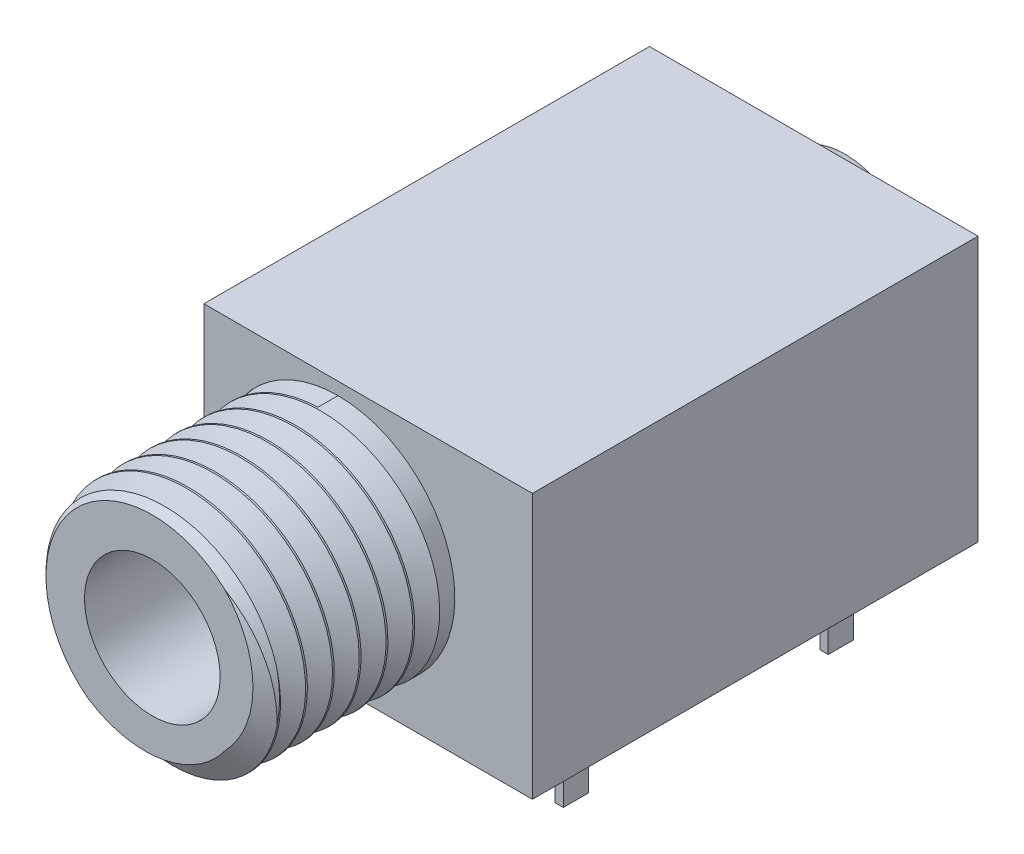
from build123d import *

# Parameters (mm, degrees)
SKETCH1_W           = 15.75
SKETCH1_H           = 21.36
BOSS_EXTRUDE1_DEPTH = 12.7
SKETCH3_R           = 4
BOSS_EXTRUDE2_DEPTH = 2.94
BOSS_EXTRUDE2_TAPER = 10
SKETCH4_R           = 5.6
BOSS_EXTRUDE3_DEPTH = 8.9
CHAMFER1_SIZE       = 0.5
CUT_SWEEP1_PITCH    = 1.285714286
SKETCH13_R          = 3.25
CUT_EXTRUDE1_DEPTH  = 29
SKETCH14_W          = 0.4
SKETCH14_H          = 1.2
BOSS_EXTRUDE4_DEPTH = 3.25


with BuildPart() as part:
    # Sketch1 → Boss-Extrude1 (new body)
    with BuildSketch(Plane(origin=(0, 0, 0), x_dir=(1, 0, 0), z_dir=(0, 1, 0))):
        with Locations((-6.725772662, 1.951732914)):
            Rectangle(SKETCH1_W, SKETCH1_H)
    extrude(amount=BOSS_EXTRUDE1_DEPTH)

    # Sketch3 → Boss-Extrude2 (add)
    with BuildSketch(Plane(origin=(0, 0, -12.631732914), x_dir=(-1, 0, 0), z_dir=(0, 0, -1))):
        with Locations((8.170772662, 6.5)):
            Circle(SKETCH3_R)
    extrude(amount=BOSS_EXTRUDE2_DEPTH, taper=BOSS_EXTRUDE2_TAPER)

    # Sketch4 → Boss-Extrude3 (add)
    with BuildSketch(Plane.XY.offset(8.728267086)):
        with Locations(Location((-8.170772662, 6.5, 0), (0, 0, 180))):
            Circle(SKETCH4_R)
    extrude(amount=BOSS_EXTRUDE3_DEPTH)

    # Chamfer1
    chamfer1_edges = [part.edges().sort_by_distance(p)[0] for p in [
        (-2.570772662, 6.5, 17.628267086),
    ]]
    chamfer(chamfer1_edges, length=CHAMFER1_SIZE)

    # Cut-Sweep1: arcs per turn and ends read off the stored shape
    # Cut-Sweep1: the profile of Sketch6 profile screwed along a right-hand helix through 7 turns, 8 arcs to a turn; built about Z, then put on its axis
    cut_sweep1_z = Axis((0, 0, 0), (0, 0, 1))
    cut_sweep1_corners = [(5.6003, 0, 0.135887491), (5.6003, 0, -1.064458919), (4.560769515, 0, -0.464285714)]
    with BuildLine(mode=Mode.PRIVATE) as cut_sweep1_profile:
        Line(cut_sweep1_corners[0], cut_sweep1_corners[1])
        Line(cut_sweep1_corners[1], cut_sweep1_corners[2])
        Line(cut_sweep1_corners[2], cut_sweep1_corners[0])
    cut_sweep1_cap = Face(cut_sweep1_profile.wire())
    cut_sweep1_turn_angles = [0, 22.5, 45, 67.5, 90, 112.5, 135, 157.5, 180, 202.5, 225, 247.5, 270, 292.5, 315, 337.5, 360]
    cut_sweep1_turn_weights = [1, 0.9238795325112867, 1, 0.9238795325112867, 1, 0.9238795325112867, 1, 0.9238795325112867, 1, 0.9238795325112867, 1, 0.9238795325112867, 1, 0.9238795325112867, 1, 0.9238795325112867, 1]
    cut_sweep1_turn_rails = [Edge.make_bspline([Vector(p[0], p[1], 0).rotate(cut_sweep1_z, cut_sweep1_turn_angles[k]) / cut_sweep1_turn_weights[k] + Vector(0, 0, p[2] + CUT_SWEEP1_PITCH * cut_sweep1_turn_angles[k] / 360) for k in range(17)], [0, 0, 0, 1, 1, 2, 2, 3, 3, 4, 4, 5, 5, 6, 6, 7, 7, 8, 8, 8], 2, cut_sweep1_turn_weights) for p in cut_sweep1_corners]
    cut_sweep1_turn_sides = [Face.make_surface_from_curves(cut_sweep1_turn_rails[p[0]], cut_sweep1_turn_rails[p[1]]) for p in [(0, 1), (1, 2), (2, 0)]]
    cut_sweep1 = Plane(origin=(-8.170772662, 6.5, 17.628267086), x_dir=(0, 1, 0), z_dir=(0, 0, -1)) * Solid(Shell([*[p.moved(Location((0, 0, CUT_SWEEP1_PITCH * i))) for i in range(7) for p in cut_sweep1_turn_sides], cut_sweep1_cap, cut_sweep1_cap.rotate(cut_sweep1_z, 2520).moved(Location((0, 0, CUT_SWEEP1_PITCH * 2520 / 360)))]))
    add(cut_sweep1, mode=Mode.SUBTRACT)

    # Sketch13 → Cut-Extrude1 (cut)
    with BuildSketch(Plane.XY.offset(17.628267086)):
        with Locations((-8.170772662, 6.5)):
            Circle(SKETCH13_R)
    extrude(amount=-CUT_EXTRUDE1_DEPTH, mode=Mode.SUBTRACT)

    # Sketch14 → Boss-Extrude4 (add)
    with BuildSketch(Plane.XZ):
        with Locations((-12.650772662, 4.478267086)):
            Rectangle(SKETCH14_W, SKETCH14_H)
        with Locations((-12.650772662, -8.221732914)):
            Rectangle(SKETCH14_W, SKETCH14_H)
        with Locations((-1.220772662, -8.221732914)):
            Rectangle(SKETCH14_W, SKETCH14_H)
        with Locations((-1.220772662, 4.478267086)):
            Rectangle(SKETCH14_W, SKETCH14_H)
    extrude(amount=BOSS_EXTRUDE4_DEPTH)


solid = part.part
